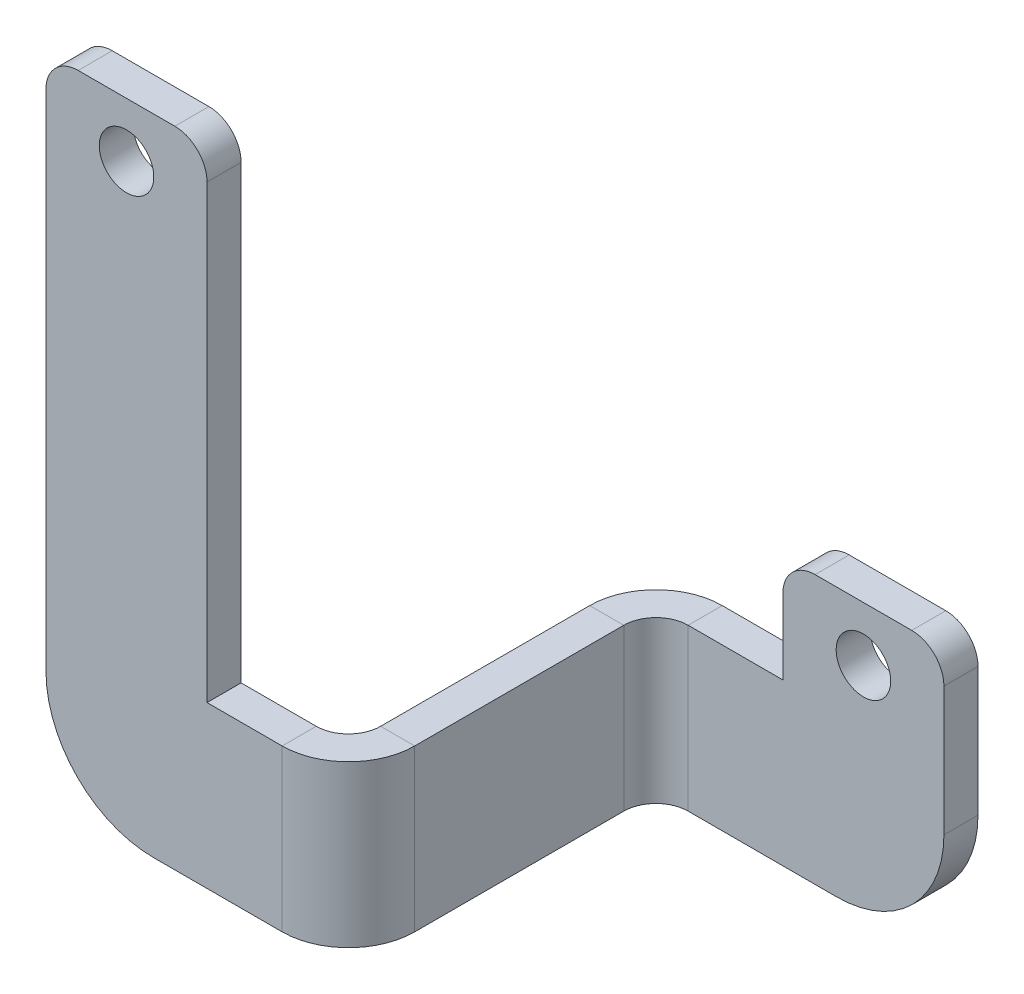
from build123d import *

# Parameters (mm, degrees)
SKETCH1_W                    = 25
SKETCH1_H                    = 15
BASE_FLANGE1_DEPTH           = 3.175
EDGE_FLANGE1_STRIP_W         = 18.7
EDGE_FLANGE1_STRIP_H         = 3.175
EDGE_FLANGE1_STRIP_CUT_DEPTH = 15
EDGE_FLANGE1_DEPTH           = 15
EDGE_FLANGE2_STRIP_W         = 18.7
EDGE_FLANGE2_STRIP_H         = 3.175
EDGE_FLANGE2_STRIP_CUT_DEPTH = 15
EDGE_FLANGE2_DEPTH           = 15
SKETCH12_W                   = 15
SKETCH12_H                   = 3.175
BOSS_EXTRUDE1_DEPTH          = 45
SKETCH15_R                   = 2.54
CUT_EXTRUDE2_DEPTH           = 74.371128518
SKETCH19_W                   = 15
SKETCH19_H                   = 3.175
BOSS_EXTRUDE2_DEPTH          = 10
SKETCH21_R                   = 2.54
CUT_EXTRUDE3_DEPTH           = 75.668136611
FILLET2_R                    = 3
FILLET3_R                    = 10


# Sheet-metal steps are written as plain solids
with BuildPart() as part:
    # Sketch1 → Base-Flange1 (new body)
    with BuildSketch(Plane.XY):
        Rectangle(SKETCH1_W, SKETCH1_H)
    extrude(amount=-BASE_FLANGE1_DEPTH)

    # Edge-Flange1 strip (across the edge) → Edge-Flange1 strip cut (cut)
    with BuildSketch(Plane(origin=(12.5, 7.5, -3.175), x_dir=(-1, 0, 0), z_dir=(0, -1, 0))):
        with Locations((-6.35, -1.5875)):
            Rectangle(EDGE_FLANGE1_STRIP_W, EDGE_FLANGE1_STRIP_H)
    extrude(amount=EDGE_FLANGE1_STRIP_CUT_DEPTH, mode=Mode.SUBTRACT)

    # Edge-Flange1 section (across the edge) → Edge-Flange1 (add)
    with BuildSketch(Plane(origin=(12.5, 7.5, -3.175), x_dir=(-1, 0, 0), z_dir=(0, -1, 0))):
        with BuildLine():
            Line((-3.175, 3), (-3.175, 25.475))
            Line((-3.175, 25.475), (0, 25.475))
            Line((0, 25.475), (0, 3))
            ThreePointArc((0, 3), (0.878679656, 0.878679656), (3, 0))
            Line((3, 0), (3, -3.175))
            ThreePointArc((3, -3.175), (-1.366384374, -1.366384374), (-3.175, 3))
        make_face()
    extrude(amount=EDGE_FLANGE1_DEPTH)

    # Edge-Flange2 strip (across the edge) → Edge-Flange2 strip cut (cut)
    with BuildSketch(Plane(origin=(15.675, -7.5, -28.65), x_dir=(0, 0, 1), z_dir=(0, 1, 0))):
        with Locations((-6.35, -1.5875)):
            Rectangle(EDGE_FLANGE2_STRIP_W, EDGE_FLANGE2_STRIP_H)
    extrude(amount=EDGE_FLANGE2_STRIP_CUT_DEPTH, mode=Mode.SUBTRACT)

    # Edge-Flange2 section (across the edge) → Edge-Flange2 (add)
    with BuildSketch(Plane(origin=(15.675, -7.5, -28.65), x_dir=(0, 0, 1), z_dir=(0, 1, 0))):
        with BuildLine():
            Line((-3.175, 3), (-3.175, 26.825))
            Line((-3.175, 26.825), (0, 26.825))
            Line((0, 26.825), (0, 3))
            ThreePointArc((0, 3), (0.878679656, 0.878679656), (3, 0))
            Line((3, 0), (3, -3.175))
            ThreePointArc((3, -3.175), (-1.366384374, -1.366384374), (-3.175, 3))
        make_face()
    extrude(amount=EDGE_FLANGE2_DEPTH)

    # Sketch12 → Boss-Extrude1 (add)
    with BuildSketch(Plane(origin=(0, 7.5, 0), x_dir=(1, 0, 0), z_dir=(0, 1, 0))):
        with Locations((-5, 1.5875)):
            Rectangle(SKETCH12_W, SKETCH12_H)
    extrude(amount=BOSS_EXTRUDE1_DEPTH)

    # Sketch15 → Cut-Extrude2 (cut, through all)
    with BuildSketch(Plane(origin=(0, 0, -3.175), x_dir=(-1, 0, 0), z_dir=(0, 0, -1))):
        with Locations((5, 47.42)):
            Circle(SKETCH15_R)
    extrude(amount=-CUT_EXTRUDE2_DEPTH, mode=Mode.SUBTRACT)

    # Sketch19 → Boss-Extrude2 (add)
    with BuildSketch(Plane(origin=(0, 7.5, 0), x_dir=(1, 0, 0), z_dir=(0, 1, 0))):
        with Locations((35, 30.2375)):
            Rectangle(SKETCH19_W, SKETCH19_H)
    extrude(amount=BOSS_EXTRUDE2_DEPTH)

    # Sketch21 → Cut-Extrude3 (cut, through all)
    with BuildSketch(Plane(origin=(0, 0, -31.825), x_dir=(-1, 0, 0), z_dir=(0, 0, -1))):
        with Locations((-35, 12.42)):
            Circle(SKETCH21_R)
    extrude(amount=-CUT_EXTRUDE3_DEPTH, mode=Mode.SUBTRACT)

    # Fillet2
    fillet2_edges = [part.edges().sort_by_distance(p)[0] for p in [
        (42.5, 17.5, -30.2375),
        (27.5, 17.5, -30.2375),
        (-12.5, 52.5, -1.5875),
        (2.5, 52.5, -1.5875),
    ]]
    fillet(fillet2_edges, radius=FILLET2_R)

    # Fillet3
    fillet3_edges = [part.edges().sort_by_distance(p)[0] for p in [
        (42.5, -7.5, -30.2375),
        (-12.5, -7.5, -1.5875),
    ]]
    fillet(fillet3_edges, radius=FILLET3_R)


solid = part.part
